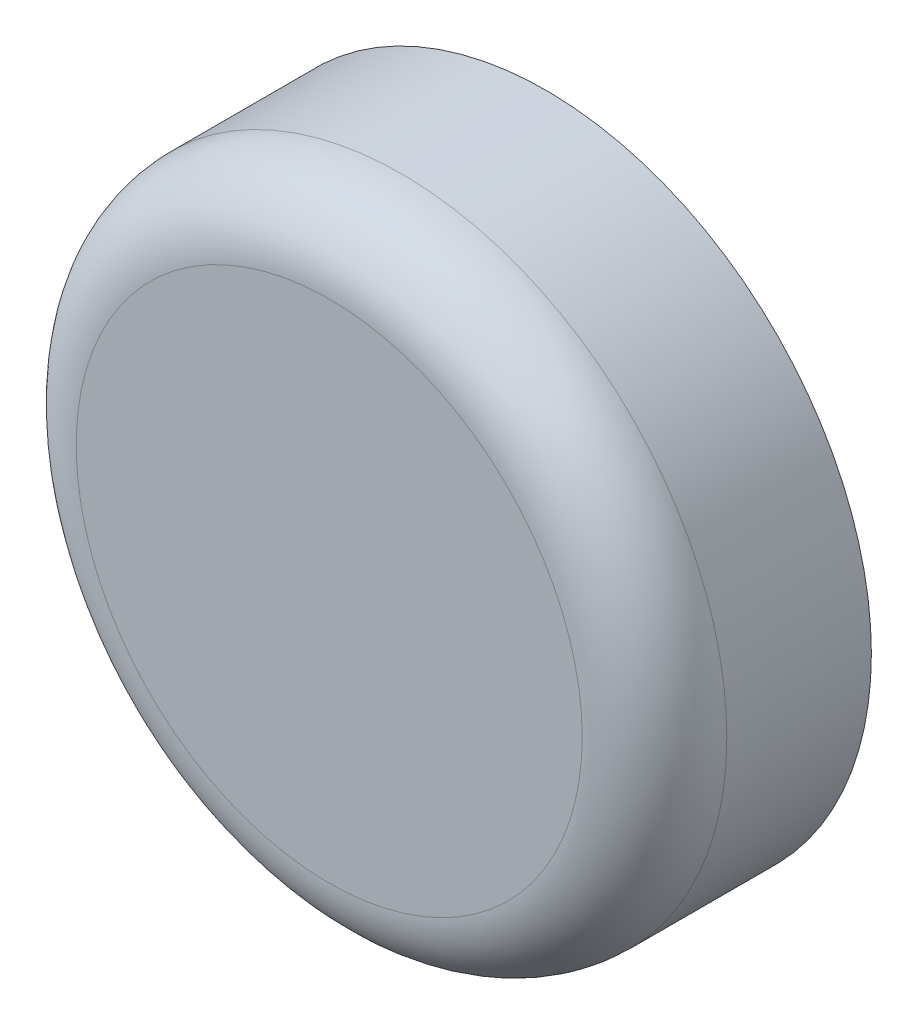
from build123d import *

# Parameters (mm, degrees)
ESQUISSE1_R             = 45
BOSS_EXTRU_1_DEPTH      = 30
CONG_1_R                = 10
ESQUISSE3_R             = 40
ESQUISSE3_R_2           = 7
ESQUISSE3_R_3           = 3.15
ENL_V_MAT_EXTRU_1_DEPTH = 15
CONG_2_R                = 10
CONG_3_R                = 5


with BuildPart() as part:
    # Esquisse1 → Boss.-Extru.1 (new body)
    with BuildSketch(Plane.XY):
        Circle(ESQUISSE1_R)
    extrude(amount=BOSS_EXTRU_1_DEPTH)

    # Congé1
    cong_1_edges = [part.edges().sort_by_distance(p)[0] for p in [
        (-45, 0, 30),
    ]]
    fillet(cong_1_edges, radius=CONG_1_R)

    # Esquisse3 → Enlèv. mat.-Extru.1 (cut)
    # profile 1 of 2: a face of its own
    with BuildSketch(Plane(origin=(0, 0, 0), x_dir=(-1, 0, 0), z_dir=(0, 0, -1))):
        Circle(ESQUISSE3_R)
        Circle(ESQUISSE3_R_2, mode=Mode.SUBTRACT)
    # profile 2 of 2: a face of its own
    with BuildSketch(Plane(origin=(0, 0, 0), x_dir=(-1, 0, 0), z_dir=(0, 0, -1))):
        Circle(ESQUISSE3_R_3)
    extrude(amount=-ENL_V_MAT_EXTRU_1_DEPTH, mode=Mode.SUBTRACT)

    # Congé2
    cong_2_edges = [part.edges().sort_by_distance(p)[0] for p in [
        (40, 0, 15),
    ]]
    fillet(cong_2_edges, radius=CONG_2_R)

    # Congé3
    cong_3_edges = [part.edges().sort_by_distance(p)[0] for p in [
        (7, 0, 15),
    ]]
    fillet(cong_3_edges, radius=CONG_3_R)


solid = part.part
